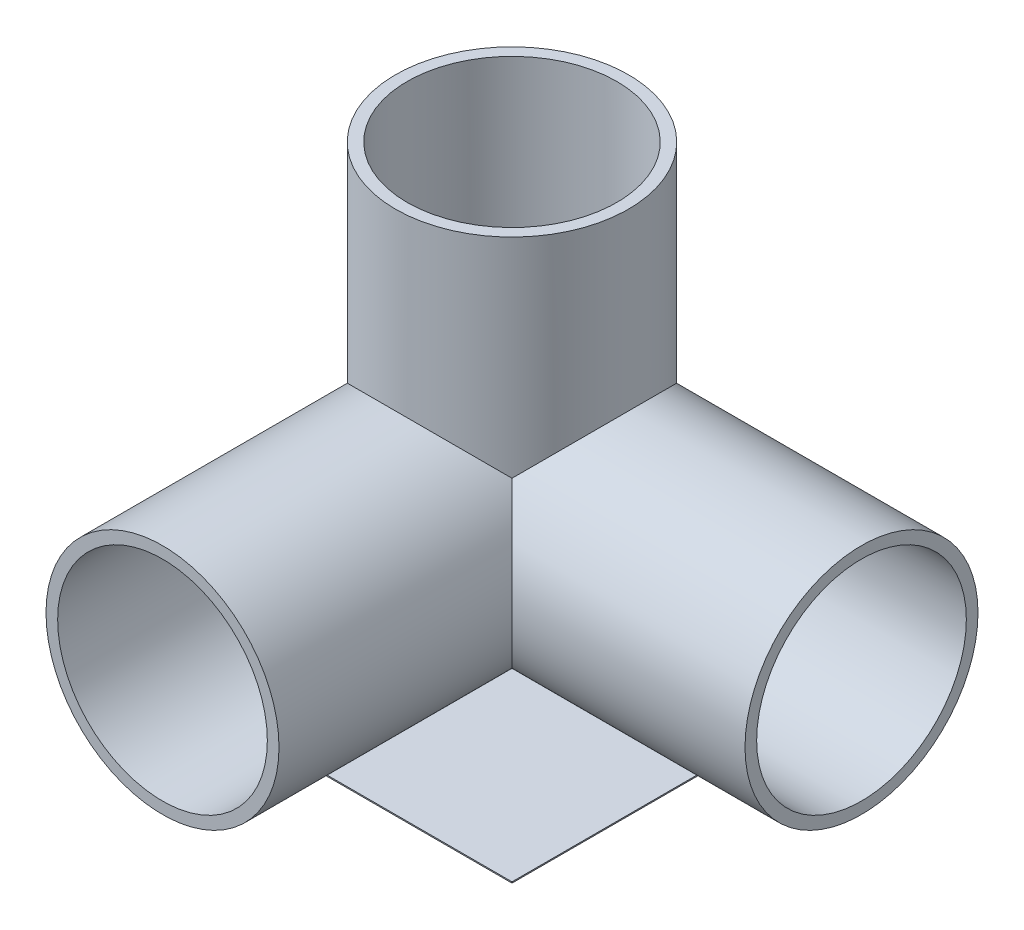
from build123d import *

# Parameters (mm, degrees)
SWEEP_1_PROFILE_R   = 10
EXTRUDE_9_REACH     = 118.9
SKETCH_19_R         = 10
SKETCH_20_R         = 9
CUT_EXTRUDE_1_DEPTH = 28
SKETCH_21_R         = 9
CUT_EXTRUDE_2_DEPTH = 28
SKETCH_22_R         = 9
CUT_EXTRUDE_4_DEPTH = 28
EXTRUDE_START       = -10
SKETCH_23_W         = 30
SKETCH_23_H         = 30
EXTRUDE_10_DEPTH    = 0.1


with BuildPart() as part:
    # 扫描1: sweep along a path in 草图9
    with BuildLine(Plane(origin=(0, 0, 0), x_dir=(1, 0, 0), z_dir=(0, 1, 0))) as sweep_1_path:
        Line((-96.490610015, -33.171355411), (-96.490610015, -3.171355411))
        Line((-96.490610015, -3.171355411), (-66.490610015, -3.171355411))
    # 扫描1 profile (on start of the path) → 扫描1 (sweep)
    with BuildSketch(Plane(origin=(-96.490610015, 0, 33.171355411), x_dir=(-1, 0, 0), z_dir=(0, 0, -1))):
        Circle(SWEEP_1_PROFILE_R)
    sweep(path=sweep_1_path.line, transition=Transition.RIGHT)

    # 草图19 → 凸台-拉伸9 (add, up to next)
    with BuildSketch(Plane(origin=(0, 25, 0), x_dir=(1, 0, 0), z_dir=(0, 1, 0)), mode=Mode.PRIVATE) as extrude_9_sk1:
        with Locations((-96.490610015, -3.171355411)):
            Circle(SKETCH_19_R)
    extrude_9_tool1 = extrude(extrude_9_sk1.sketch, amount=-EXTRUDE_9_REACH, mode=Mode.PRIVATE) - part.part
    add(extrude_9_tool1.solids().sort_by_distance((-96.49061, 25, 3.171355))[0])

    # 草图20 → 切除-拉伸1 (cut)
    with BuildSketch(Plane.XY.offset(33.171355411)):
        with Locations((-96.490610015, 0)):
            Circle(SKETCH_20_R)
    extrude(amount=-CUT_EXTRUDE_1_DEPTH, mode=Mode.SUBTRACT)

    # 草图21 → 切除-拉伸2 (cut)
    with BuildSketch(Plane(origin=(-66.490610015, 0, 0), x_dir=(0, 0, -1), z_dir=(1, 0, 0))):
        with Locations((-3.171355411, 0)):
            Circle(SKETCH_21_R)
    extrude(amount=-CUT_EXTRUDE_2_DEPTH, mode=Mode.SUBTRACT)

    # 草图22 → 切除-拉伸4 (cut)
    with BuildSketch(Plane(origin=(0, 25, 0), x_dir=(1, 0, 0), z_dir=(0, 1, 0))):
        with Locations((-96.490610015, -3.171355411)):
            Circle(SKETCH_22_R)
    extrude(amount=-CUT_EXTRUDE_4_DEPTH, mode=Mode.SUBTRACT)


with BuildPart() as body_2:
    # 草图23 → 凸台-拉伸10 (new body)
    with BuildSketch(Plane(origin=(0, 0, 0), x_dir=(1, 0, 0), z_dir=(0, 1, 0)).offset(EXTRUDE_START)):
        with Locations((-91.490610015, -8.171355411)):
            Rectangle(SKETCH_23_W, SKETCH_23_H)
    extrude(amount=-EXTRUDE_10_DEPTH)


solid = Compound([part.part, body_2.part])
